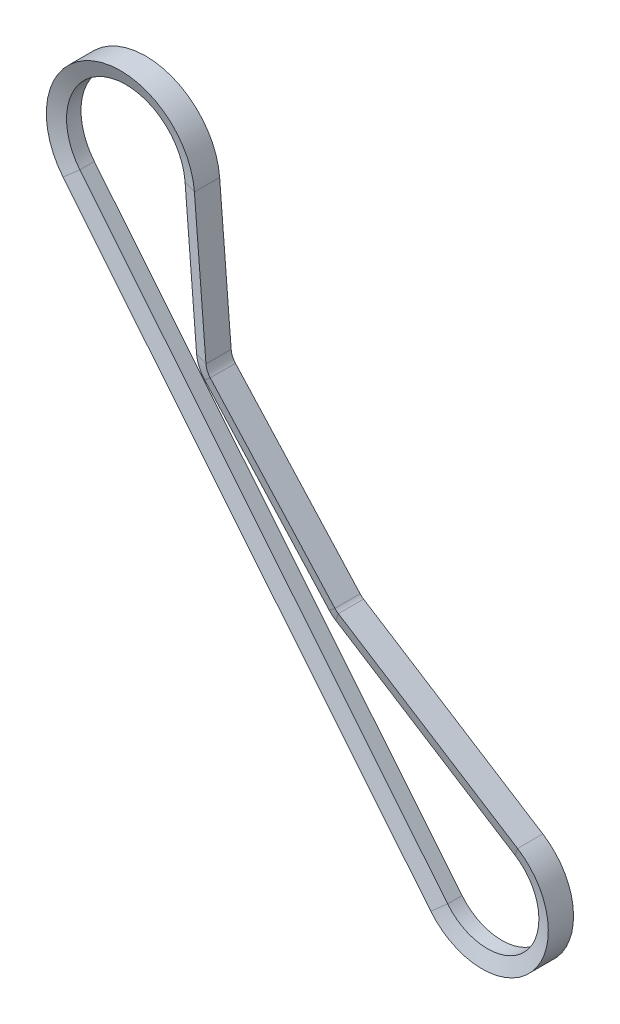
from build123d import *


with BuildPart() as part:
    # Sweep1: sweep along a path in Sketch2
    with BuildLine(Plane.XY) as sweep1_path:
        Line((-19.389856933, -15.780793646), (-158.247928863, 154.834082199))
        ThreePointArc((-158.247928863, 154.834082199), (-146.961647492, 198.493328611), (-108.621491736, 174.754280588))
        Line((-108.621491736, 174.754280588), (-104.273304741, 120.714780971))
        ThreePointArc((-104.273304741, 120.714780971), (-103.77045523, 118.699766171), (-102.64434676, 116.954767035))
        Line((-102.64434676, 116.954767035), (-55.581100477, 65.137290742))
        ThreePointArc((-55.581100477, 65.137290742), (-54.968354449, 64.547374297), (-54.282265136, 64.044641205))
        Line((-54.282265136, 64.044641205), (13.392716569, 21.110072072))
        ThreePointArc((13.392716569, 21.110072072), (18.687573853, -16.6064621), (-19.389856933, -15.780793646))
    # Sketch3 → Sweep1 (sweep)
    with BuildSketch(Plane(origin=(13.392716569, 21.110072072, 0), x_dir=(-0.5357086627593828, -0.8444028828968752, 0), z_dir=(0.8444028828968752, -0.5357086627593828, 0))):
        Polygon((0, -4.7625), (0, 4.7625), (5.588, 2.728634331), (5.588, -2.728634331), align=None)
    sweep(path=sweep1_path.line)


solid = part.part
